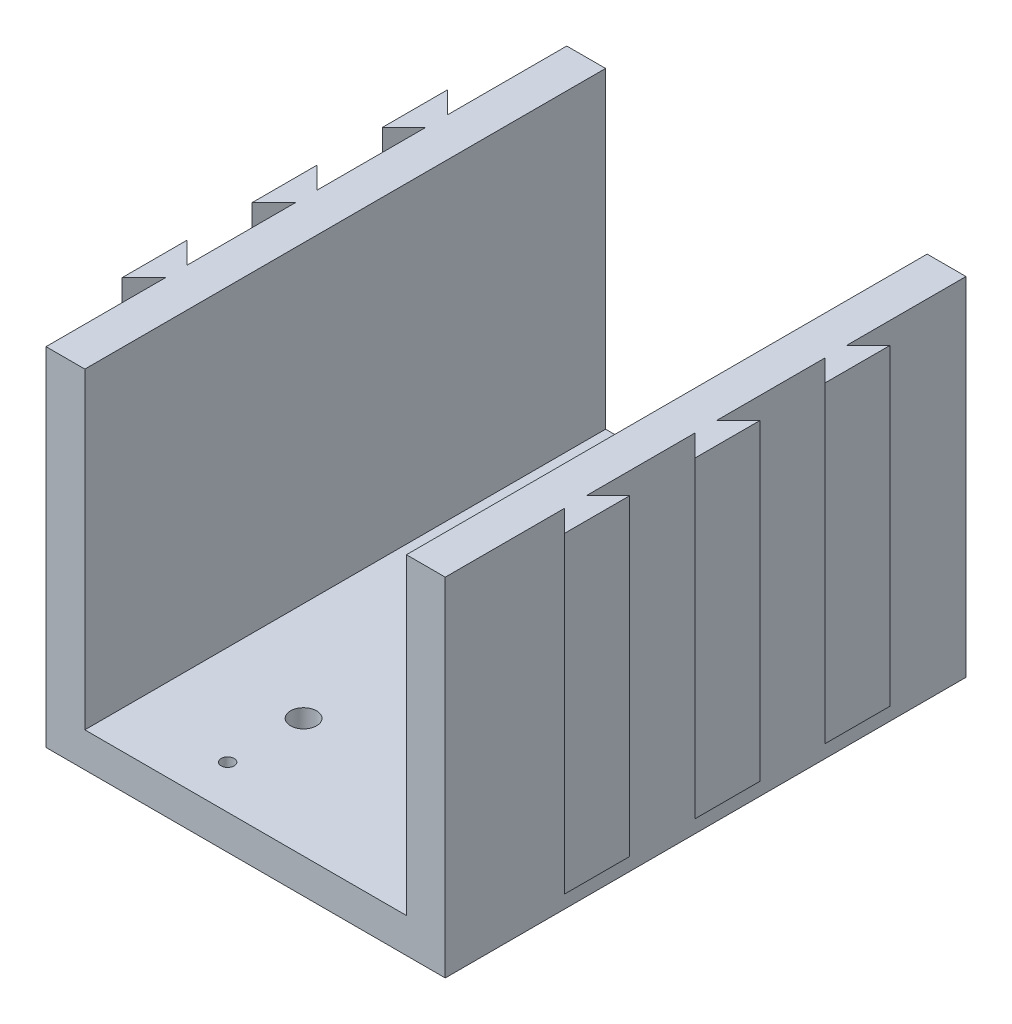
from build123d import *

# Parameters (mm, degrees)
SKETCH1_W           = 92
SKETCH1_H           = 120
BOSS_EXTRUDE1_DEPTH = 8
BOSS_EXTRUDE2_DEPTH = 72
CUT_EXTRUDE1_REACH  = 175.807
SKETCH3_R           = 3
SKETCH3_R_2         = 1.5


with BuildPart() as part:
    # Sketch1 → Boss-Extrude1 (new body)
    with BuildSketch(Plane(origin=(0, 0, 0), x_dir=(1, 0, 0), z_dir=(0, 1, 0))):
        with Locations((46, 60)):
            Rectangle(SKETCH1_W, SKETCH1_H)
    extrude(amount=BOSS_EXTRUDE1_DEPTH)

    # Sketch2 → Boss-Extrude2 (add)
    with BuildSketch(Plane(origin=(0, 8, 0), x_dir=(1, 0, 0), z_dir=(0, 1, 0))):
        Polygon((0, 120), (8.948645063, 120), (8.948645063, 0), (0, 0), (0, 27.5), (-5, 22.5), (-5, 37.5), (0, 32.5), (0, 57.5), (-5, 52.5), (-5, 67.5), (0, 62.5), (0, 87.5), (-5, 82.5), (-5, 97.5), (0, 92.5), align=None)
        Polygon((92, 57.5), (92, 32.5), (97, 37.5), (97, 22.5), (92, 27.5), (92, 0), (83.051354937, 0), (83.051354937, 120), (92, 120), (92, 92.5), (97, 97.5), (97, 82.5), (92, 87.5), (92, 62.5), (97, 67.5), (97, 52.5), align=None)
    extrude(amount=BOSS_EXTRUDE2_DEPTH)

    # Sketch3 → Cut-Extrude1 (cut, up to next)
    with BuildSketch(Plane.XZ, mode=Mode.PRIVATE) as cut_extrude1_sk1:
        with Locations((31.85, -92.5)):
            Circle(SKETCH3_R)
    cut_extrude1_tool1 = extrude(cut_extrude1_sk1.sketch, amount=-CUT_EXTRUDE1_REACH, mode=Mode.PRIVATE) & part.part
    # Sketch3 → Cut-Extrude1 (cut, up to next)
    with BuildSketch(Plane.XZ, mode=Mode.PRIVATE) as cut_extrude1_sk2:
        with Locations((31.85, -110)):
            Circle(SKETCH3_R_2)
    cut_extrude1_tool2 = extrude(cut_extrude1_sk2.sketch, amount=-CUT_EXTRUDE1_REACH, mode=Mode.PRIVATE) & part.part
    # Sketch3 → Cut-Extrude1 (cut, up to next)
    with BuildSketch(Plane.XZ, mode=Mode.PRIVATE) as cut_extrude1_sk3:
        with Locations((31.85, -10)):
            Circle(SKETCH3_R_2)
    cut_extrude1_tool3 = extrude(cut_extrude1_sk3.sketch, amount=-CUT_EXTRUDE1_REACH, mode=Mode.PRIVATE) & part.part
    # Sketch3 → Cut-Extrude1 (cut, up to next)
    with BuildSketch(Plane.XZ, mode=Mode.PRIVATE) as cut_extrude1_sk4:
        with Locations((31.85, -27.5)):
            Circle(SKETCH3_R)
    cut_extrude1_tool4 = extrude(cut_extrude1_sk4.sketch, amount=-CUT_EXTRUDE1_REACH, mode=Mode.PRIVATE) & part.part
    add(cut_extrude1_tool1.solids().sort_by_distance((31.85, 0, -92.5))[0], mode=Mode.SUBTRACT)
    add(cut_extrude1_tool2.solids().sort_by_distance((31.85, 0, -110))[0], mode=Mode.SUBTRACT)
    add(cut_extrude1_tool3.solids().sort_by_distance((31.85, 0, -10))[0], mode=Mode.SUBTRACT)
    add(cut_extrude1_tool4.solids().sort_by_distance((31.85, 0, -27.5))[0], mode=Mode.SUBTRACT)


solid = part.part
